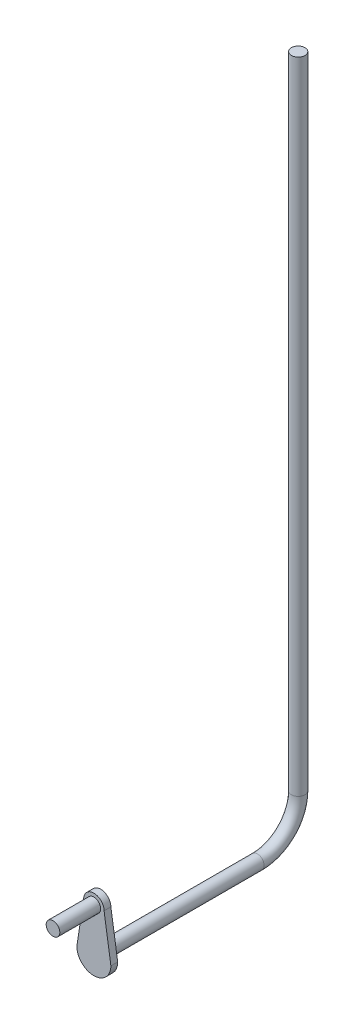
from build123d import *

# Parameters (mm, degrees)
SKETCH1_R           = 10
BOSS_EXTRUDE1_DEPTH = 10
SKETCH2_R           = 10
BOSS_EXTRUDE2_DEPTH = 60
SWEEP1_START        = 59.9999999
SWEEP1_OUTLINE_R    = 10
SWEEP1_DEPTH        = 940.0000001
SWEEP1_START_2      = -230.0000001
SWEEP1_2_OUTLINE_R  = 10
SWEEP1_2_DEPTH      = 240.0000001
SWEEP1_3_OUTLINE_R  = 10
SWEEP1_3_ANGLE      = 90


with BuildPart() as part:
    # Sketch1 → Boss-Extrude1 (new body)
    with BuildSketch(Plane.XY):
        with BuildLine():
            ThreePointArc((15, 65), (0, 80), (-15, 65))
            Line((-15, 65), (-23.843930636, 7.514450867))
            Line((-23.843930636, 7.514450867), (-25, 0))
            ThreePointArc((-25, 0), (0, -25), (25, 0))
            Line((25, 0), (23.843930636, 7.514450867))
            Line((23.843930636, 7.514450867), (15, 65))
        make_face()
        Circle(SKETCH1_R, mode=Mode.SUBTRACT)
    extrude(amount=BOSS_EXTRUDE1_DEPTH)

    # Sketch2 → Boss-Extrude2 (add)
    with BuildSketch(Plane.XY.offset(10)):
        with Locations((0, 65)):
            Circle(SKETCH2_R)
    extrude(amount=BOSS_EXTRUDE2_DEPTH)

    # Sweep1 2 outline → Sweep1 2 (add)
    with BuildSketch(Plane.XY.offset(SWEEP1_START_2)):
        Circle(SWEEP1_2_OUTLINE_R)
    extrude(amount=SWEEP1_2_DEPTH)



with BuildPart() as body_2:
    # Sweep1: read off the stored shape, not the designer's step
    # Sweep1 outline → Sweep1 (new body)
    with BuildSketch(Plane(origin=(0, 0, 0), x_dir=(1, 0, 0), z_dir=(0, 1, 0)).offset(SWEEP1_START)):
        with Locations((0, 290)):
            Circle(SWEEP1_OUTLINE_R)
    extrude(amount=SWEEP1_DEPTH)


with BuildPart() as part_1:
    add(part.part)

    add(body_2.part)  # Sweep1 3 merges body 2
    # Sweep1 3 outline → Sweep1 3 (revolve)
    with BuildSketch(Plane(origin=(0, 60, -230), x_dir=(0, -1, 0), z_dir=(0, 0, 1))):
        with Locations((60, 0)):
            Circle(SWEEP1_3_OUTLINE_R)
    revolve(axis=Axis((0, 60, -230), (1, 0, 0)), revolution_arc=SWEEP1_3_ANGLE)


solid = part_1.part
